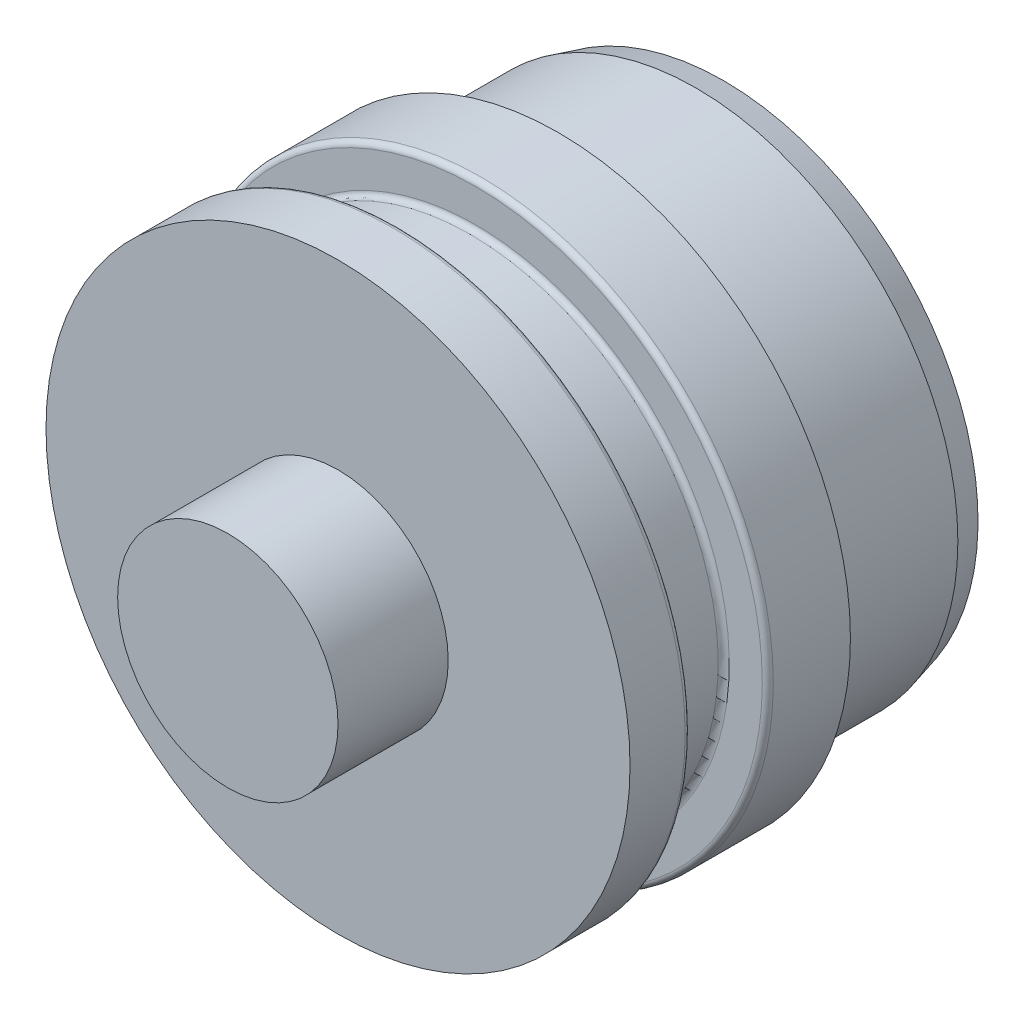
from build123d import *

# Parameters (mm, degrees)
CHAMFER1_SIZE  = 1.27
CHAMFER1_SIZE2 = 0.340295474
FILLET1_R      = 0.254


with BuildPart() as part:
    # Sketch1 → Revolve1 (revolve)
    with BuildSketch(Plane(origin=(0, 0, 0), x_dir=(0, 0, -1), z_dir=(1, 0, 0))):
        Polygon((0, 5.08), (0, 13.462), (2.794, 13.462), (2.794, 11.43), (6.35, 11.43), (6.35, 13.462), (10.16, 13.462), (10.16, 12.065), (17.78, 12.065), (17.78, 6.731), (5.08, 6.731), (5.08, 0), (0, 0), (-5.08, 0), (-5.08, 5.08), align=None)
    revolve(axis=Axis((0, 0, -5.08), (0, 0, 1)))

    # Chamfer1
    chamfer1_edges = [part.edges().sort_by_distance(p)[0] for p in [
        (0, -12.065, -17.78),
    ]]
    chamfer1_side = [part.faces().sort_by_distance(p)[0] for p in [
        (0, -12.065, -13.97),
    ]]
    chamfer(chamfer1_edges, length=CHAMFER1_SIZE, length2=CHAMFER1_SIZE2, reference=chamfer1_side[0])

    # Fillet1
    fillet1_edges = [part.edges().sort_by_distance(p)[0] for p in [
        (0, -13.462, -2.794),
        (0, -11.43, -2.794),
        (0, -11.43, -6.35),
        (0, -13.462, -6.35),
    ]]
    fillet(fillet1_edges, radius=FILLET1_R)


solid = part.part
